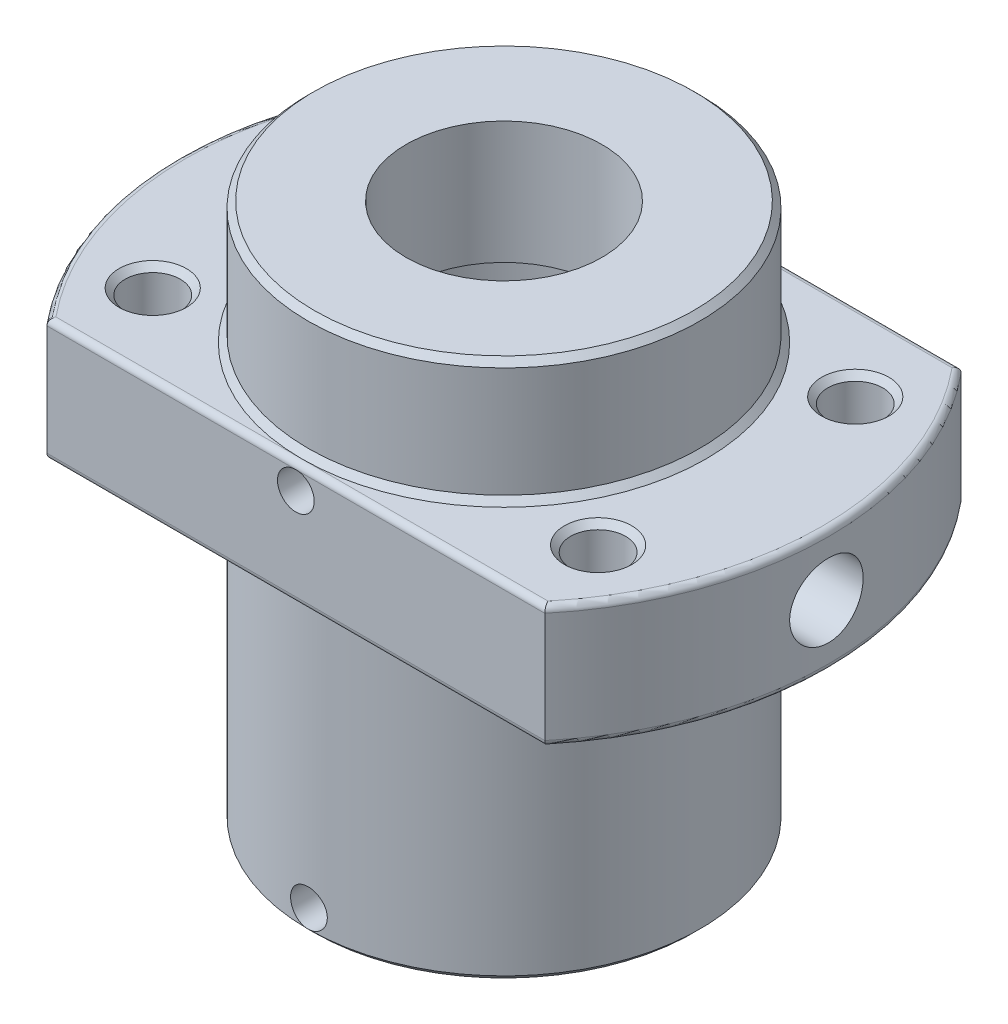
from build123d import *

# Parameters (mm, degrees)
CUT_EXTRUDE2_REACH      = 52.601
CUT_EXTRUDE3_REACH      = 48.338
SKETCH4_R               = 2.25
CHAMFER1_SIZE           = 0.5
CUT_EXTRUDE4_REACH      = 67.223
CUT_EXTRUDE4_END_RADIUS = 11
SKETCH5_R               = 2.5
SKETCH6_R               = 3
CUT_EXTRUDE5_DEPTH      = 10
FILLET1_R               = 0.5
SKETCH7_R               = 1.5
CUT_EXTRUDE6_DEPTH      = 55.902185865
SKETCH8_R               = 1.5
CUT_EXTRUDE7_DEPTH      = 28
CUT_SWEEP1_PITCH        = 5
CUT_SWEEP1_FROM         = 10


with BuildPart() as part:
    # Sketch1 → Revolve1 (revolve)
    with BuildSketch(Plane(origin=(0, 0, 0), x_dir=(0, 0, -1), z_dir=(1, 0, 0))):
        Polygon((-16, 0), (-26.5, 0), (-26.5, -10), (-16, -10), (-16, -34), (-11, -34), (-11, -24), (-8, -24), (-8, -10), (-11, -10), (-11, 0), (-8, 0), (-8, 10), (-16, 10), align=None)
    revolve(axis=Axis((0, 0, 0), (0, -1, 0)))

    # Sketch2 → Cut-Extrude2 (cut, up to next)
    with BuildSketch(Plane(origin=(0, 0, 0), x_dir=(1, 0, 0), z_dir=(0, 1, 0)), mode=Mode.PRIVATE) as cut_extrude2_sk1:
        with BuildLine():
            Line((-22.248595461, 17), (22.248595461, 17))
            ThreePointArc((22.248595461, 17), (0, 28), (-22.248595461, 17))
        make_face()
    cut_extrude2_tool1 = extrude(cut_extrude2_sk1.sketch, amount=-CUT_EXTRUDE2_REACH, mode=Mode.PRIVATE) & part.part
    # Sketch2 → Cut-Extrude2 (cut, up to next)
    with BuildSketch(Plane(origin=(0, 0, 0), x_dir=(1, 0, 0), z_dir=(0, 1, 0)), mode=Mode.PRIVATE) as cut_extrude2_sk2:
        with BuildLine():
            Line((-22.248595461, -17), (22.248595461, -17))
            ThreePointArc((22.248595461, -17), (0, -28), (-22.248595461, -17))
        make_face()
    cut_extrude2_tool2 = extrude(cut_extrude2_sk2.sketch, amount=-CUT_EXTRUDE2_REACH, mode=Mode.PRIVATE) & part.part
    add(cut_extrude2_tool1.solids().sort_by_distance((0, 0, -21.48367))[0], mode=Mode.SUBTRACT)
    add(cut_extrude2_tool2.solids().sort_by_distance((0, 0, 21.48367))[0], mode=Mode.SUBTRACT)

    # Sketch4 → Cut-Extrude3 (cut, up to next)
    with BuildSketch(Plane(origin=(0, 0, 0), x_dir=(1, 0, 0), z_dir=(0, 1, 0)), mode=Mode.PRIVATE) as cut_extrude3_sk1:
        with Locations(Location((-18.186533479, -10.5, 0), (0, 0, 270))):
            Circle(SKETCH4_R)
    cut_extrude3_tool1 = extrude(cut_extrude3_sk1.sketch, amount=-CUT_EXTRUDE3_REACH, mode=Mode.PRIVATE) & part.part
    # Sketch4 → Cut-Extrude3 (cut, up to next)
    with BuildSketch(Plane(origin=(0, 0, 0), x_dir=(1, 0, 0), z_dir=(0, 1, 0)), mode=Mode.PRIVATE) as cut_extrude3_sk2:
        with Locations(Location((-18.186533479, 10.5, 0), (0, 0, 90))):
            Circle(SKETCH4_R)
    cut_extrude3_tool2 = extrude(cut_extrude3_sk2.sketch, amount=-CUT_EXTRUDE3_REACH, mode=Mode.PRIVATE) & part.part
    # Sketch4 → Cut-Extrude3 (cut, up to next)
    with BuildSketch(Plane(origin=(0, 0, 0), x_dir=(1, 0, 0), z_dir=(0, 1, 0)), mode=Mode.PRIVATE) as cut_extrude3_sk3:
        with Locations(Location((18.186533479, -10.5, 0), (0, 0, 90))):
            Circle(SKETCH4_R)
    cut_extrude3_tool3 = extrude(cut_extrude3_sk3.sketch, amount=-CUT_EXTRUDE3_REACH, mode=Mode.PRIVATE) & part.part
    # Sketch4 → Cut-Extrude3 (cut, up to next)
    with BuildSketch(Plane(origin=(0, 0, 0), x_dir=(1, 0, 0), z_dir=(0, 1, 0)), mode=Mode.PRIVATE) as cut_extrude3_sk4:
        with Locations(Location((18.186533479, 10.5, 0), (0, 0, 270))):
            Circle(SKETCH4_R)
    cut_extrude3_tool4 = extrude(cut_extrude3_sk4.sketch, amount=-CUT_EXTRUDE3_REACH, mode=Mode.PRIVATE) & part.part
    add(cut_extrude3_tool1.solids().sort_by_distance((-18.186533, 0, 10.5))[0], mode=Mode.SUBTRACT)
    add(cut_extrude3_tool2.solids().sort_by_distance((-18.186533, 0, -10.5))[0], mode=Mode.SUBTRACT)
    add(cut_extrude3_tool3.solids().sort_by_distance((18.186533, 0, 10.5))[0], mode=Mode.SUBTRACT)
    add(cut_extrude3_tool4.solids().sort_by_distance((18.186533, 0, -10.5))[0], mode=Mode.SUBTRACT)

    # Chamfer1
    chamfer1_edges = [part.edges().sort_by_distance(p)[0] for p in [
        (0, -34, -16),
        (0, -34, -11),
        (0, -24, -8),
        (0, -10, -8),
        (0, 10, -16),
        (-18.186533479, -10, 8.25),
        (-18.186533479, 0, 8.25),
        (-18.186533479, -10, -8.25),
        (-18.186533479, 0, -8.25),
        (18.186533479, -10, 12.75),
        (18.186533479, 0, 12.75),
        (18.186533479, -10, -12.75),
        (18.186533479, 0, -12.75),
        (0, 0, -16),
    ]]
    chamfer(chamfer1_edges, length=CHAMFER1_SIZE)

    # Cut-Extrude4: up to this cylinder (the profile starts outside it)
    cut_extrude4_end = Plane(origin=(0, -5.000195, 0), z_dir=(0, 1, 0)) * Cylinder(CUT_EXTRUDE4_END_RADIUS, 157.446, mode=Mode.PRIVATE)
    # Sketch5 → Cut-Extrude4 (cut, up to the surface)
    with BuildSketch(Plane(origin=(26.5, 0, 0), x_dir=(0, 0, -1), z_dir=(1, 0, 0)), mode=Mode.PRIVATE) as cut_extrude4_sk1:
        with Locations((0, -5.000195071)):
            Circle(SKETCH5_R)
    cut_extrude4_tool1 = extrude(cut_extrude4_sk1.sketch, amount=-CUT_EXTRUDE4_REACH, mode=Mode.PRIVATE) - cut_extrude4_end
    add(cut_extrude4_tool1.solids().sort_by_distance((26.5, -5.000195, 0))[0], mode=Mode.SUBTRACT)

    # Sketch6 → Cut-Extrude5 (cut)
    with BuildSketch(Plane(origin=(26.5, 0, 0), x_dir=(0, 0, -1), z_dir=(1, 0, 0))):
        with Locations((0, -5.000195071)):
            Circle(SKETCH6_R)
    extrude(amount=-CUT_EXTRUDE5_DEPTH, mode=Mode.SUBTRACT)

    # Fillet1
    fillet1_edges = [part.edges().sort_by_distance(p)[0] for p in [
        (26.5, -10, 0),
        (0, -10, -16),
        (0, 0, 17),
        (0, -10, 17),
        (-26.5, 0, 0),
        (-26.5, -10, 0),
        (0, 0, -17),
        (0, -10, -17),
        (26.5, 0, 0),
    ]]
    fillet(fillet1_edges, radius=FILLET1_R - 0.0001)  # a hair under: the kernel refuses the full size

    # Sketch7 → Cut-Extrude6 (cut, through all)
    with BuildSketch(Plane.XY.offset(17)):
        with Locations((0, -2)):
            Circle(SKETCH7_R)
    extrude(amount=-CUT_EXTRUDE6_DEPTH, mode=Mode.SUBTRACT)

    # Sketch8 → Cut-Extrude7 (cut)
    with BuildSketch(Plane.XY.offset(16)):
        with Locations(Location((0, -32, 0), (0, 0, 90))):
            Circle(SKETCH8_R)
    extrude(amount=-CUT_EXTRUDE7_DEPTH, mode=Mode.SUBTRACT)

    # Cut-Sweep1: arcs per turn and ends read off the stored shape
    # Cut-Sweep1: the profile of Sketch10 screwed along a right-hand helix through 9.799997 turns, 12 arcs to a turn; built about Z, then put on its axis
    cut_sweep1_z = Axis((0, 0, 0), (0, 0, 1))
    cut_sweep1_corners = [(6.1, 0, -5), (8, 0, -6.9), (9.9, 0, -5), (8, 0, -3.1)]
    with BuildLine(mode=Mode.PRIVATE) as cut_sweep1_profile:
        ThreePointArc((6.1, 0, -5), (6.656497116, 0, -6.343502884), (8, 0, -6.9))
        ThreePointArc((8, 0, -6.9), (9.343502884, 0, -6.343502884), (9.9, 0, -5))
        ThreePointArc((9.9, 0, -5), (9.343502884, 0, -3.656497116), (8, 0, -3.1))
        ThreePointArc((8, 0, -3.1), (6.656497116, 0, -3.656497116), (6.1, 0, -5))
    cut_sweep1_cap = Face(cut_sweep1_profile.wire())
    cut_sweep1_arcs = [((6.1, 0, -5), (6.1, 0, -6.9), (8, 0, -6.9), (1, 0.7071067811865476, 1)), ((8, 0, -6.9), (9.9, 0, -6.9), (9.9, 0, -5), (1, 0.7071067811865476, 1)), ((9.9, 0, -5), (9.9, 0, -3.1), (8, 0, -3.1), (1, 0.7071067811865476, 1)), ((8, 0, -3.1), (6.1, 0, -3.1), (6.1, 0, -5), (1, 0.7071067811865476, 1))]  # start, shoulder, end, weights
    cut_sweep1_turn_angles = [0, 15, 30, 45, 60, 75, 90, 105, 120, 135, 150, 165, 180, 195, 210, 225, 240, 255, 270, 285, 300, 315, 330, 345, 360]
    cut_sweep1_turn_weights = [1, 0.9659258262890683, 1, 0.9659258262890683, 1, 0.9659258262890683, 1, 0.9659258262890683, 1, 0.9659258262890683, 1, 0.9659258262890683, 1, 0.9659258262890683, 1, 0.9659258262890683, 1, 0.9659258262890683, 1, 0.9659258262890683, 1, 0.9659258262890683, 1, 0.9659258262890683, 1]
    cut_sweep1_turn_sides = [Face.make_bezier_surface([[Vector(p[j][0], p[j][1], 0).rotate(cut_sweep1_z, cut_sweep1_turn_angles[2 * i + k]) / cut_sweep1_turn_weights[2 * i + k] + Vector(0, 0, p[j][2] + CUT_SWEEP1_PITCH * cut_sweep1_turn_angles[2 * i + k] / 360) for k in range(3)] for j in range(3)], [[p[3][j] * cut_sweep1_turn_weights[2 * i + k] for k in range(3)] for j in range(3)]) for p in cut_sweep1_arcs for i in range(12)]
    cut_sweep1_last_angles = [3240, 3255, 3270, 3285, 3300, 3315, 3330, 3345, 3360, 3375, 3390, 3405, 3420, 3435, 3450, 3465, 3480, 3495, 3510, 3518.9995, 3527.999]
    cut_sweep1_last_weights = [1, 0.9659258262890683, 1, 0.9659258262890683, 1, 0.9659258262890683, 1, 0.9659258262890683, 1, 0.9659258262890683, 1, 0.9659258262890683, 1, 0.9659258262890683, 1, 0.9659258262890683, 1, 0.9659258262890683, 1, 0.9876897057057689, 1]
    cut_sweep1_last_sides = [Face.make_bezier_surface([[Vector(p[j][0], p[j][1], 0).rotate(cut_sweep1_z, cut_sweep1_last_angles[2 * i + k]) / cut_sweep1_last_weights[2 * i + k] + Vector(0, 0, p[j][2] + CUT_SWEEP1_PITCH * cut_sweep1_last_angles[2 * i + k] / 360) for k in range(3)] for j in range(3)], [[p[3][j] * cut_sweep1_last_weights[2 * i + k] for k in range(3)] for j in range(3)]) for p in cut_sweep1_arcs for i in range(10)]
    cut_sweep1 = Plane(origin=(0, 0, 0), x_dir=(0, 0, 1), z_dir=(0, -1, 0)) * split(Solid(Shell([*[p.moved(Location((0, 0, CUT_SWEEP1_PITCH * i))) for i in range(9) for p in cut_sweep1_turn_sides], *cut_sweep1_last_sides, cut_sweep1_cap, cut_sweep1_cap.rotate(cut_sweep1_z, 3527.999).moved(Location((0, 0, CUT_SWEEP1_PITCH * 3527.999 / 360)))])), bisect_by=Plane.XY.offset(CUT_SWEEP1_FROM), keep=Keep.TOP, mode=Mode.PRIVATE)
    add(cut_sweep1, mode=Mode.SUBTRACT)


solid = part.part
